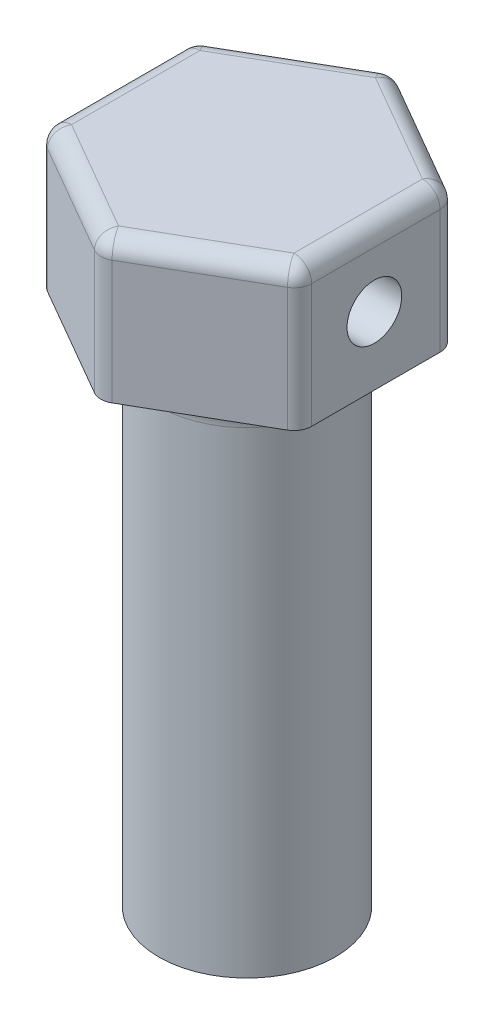
from build123d import *

# Parameters (mm, degrees)
BOSS_EXTRUDE1_DEPTH = 8
SKETCH2_R           = 5
BOSS_EXTRUDE2_DEPTH = 29
FILLET1_R           = 2
SKETCH3_R           = 1.55
CUT_EXTRUDE1_DEPTH  = 34.544199697
FILLET2_R           = 1
CUT_EXTRUDE3_START  = -2
SKETCH5_R           = 2.0875
CUT_EXTRUDE3_DEPTH  = 2


with BuildPart() as part:
    # Sketch1 → Boss-Extrude1 (new body)
    with BuildSketch(Plane(origin=(0, 0, 0), x_dir=(1, 0, 0), z_dir=(0, 1, 0))):
        Polygon((7.3, -4.214656965), (7.3, 4.214656965), (0, 8.42931393), (-7.3, 4.214656965), (-7.3, -4.214656965), (0, -8.42931393), align=None)
    extrude(amount=BOSS_EXTRUDE1_DEPTH)

    # Sketch2 → Boss-Extrude2 (add)
    with BuildSketch(Plane.XZ):
        Circle(SKETCH2_R)
        with BuildLine():
            Line((-1.5, 1.451776928), (-1.5, -1.451776928))
            ThreePointArc((-1.5, -1.451776928), (2.0875, 0), (-1.5, 1.451776928))
        make_face(mode=Mode.SUBTRACT)
    extrude(amount=BOSS_EXTRUDE2_DEPTH)

    # Fillet1
    fillet1_edges = [part.edges().sort_by_distance(p)[0] for p in [
        (-5, 0, 0),
    ]]
    fillet(fillet1_edges, radius=FILLET1_R)

    # Sketch3 → Cut-Extrude1 (cut, through all)
    with BuildSketch(Plane(origin=(7.3, 0, 0), x_dir=(0, 0, -1), z_dir=(1, 0, 0))):
        with Locations((-0.085343035, 3.85)):
            Circle(SKETCH3_R)
    extrude(amount=-CUT_EXTRUDE1_DEPTH, mode=Mode.SUBTRACT)

    # Fillet2
    fillet2_edges = [part.edges().sort_by_distance(p)[0] for p in [
        (-3.65, 8, 6.321985448),
        (-7.3, 8, 0),
        (-3.65, 8, -6.321985448),
        (3.65, 8, -6.321985448),
        (7.3, 8, 0),
        (3.65, 8, 6.321985448),
        (-7.3, 4, -4.214656965),
        (0, 4, -8.42931393),
        (7.3, 4, -4.214656965),
        (7.3, 4, 4.214656965),
        (0, 4, 8.42931393),
        (-7.3, 4, 4.214656965),
    ]]
    fillet(fillet2_edges, radius=FILLET2_R)

    # Sketch5 → Cut-Extrude3 (cut)
    with BuildSketch(Plane.XZ.offset(29).offset(CUT_EXTRUDE3_START)):
        Circle(SKETCH5_R)
    extrude(amount=CUT_EXTRUDE3_DEPTH, mode=Mode.SUBTRACT)


solid = part.part
